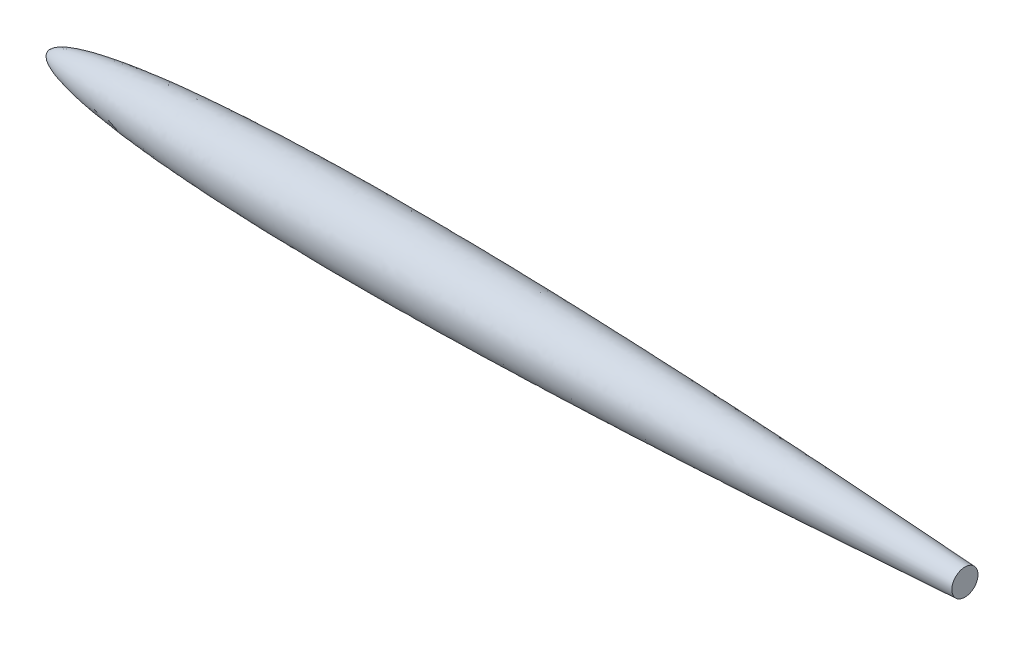
from build123d import *

# Parameters (mm, degrees)
SKETCH3_R          = 660
CUT_EXTRUDE3_DEPTH = 2750


with BuildPart() as part:
    # Sketch2 → Revolve1 (revolve)
    with BuildSketch(Plane(origin=(0, 0, 0), x_dir=(1, 0, 0), z_dir=(0, 1, 0))):
        with BuildLine():
            Line((0, 0), (10999.999999956, 0))
            add(Edge.make_bspline(
                [(0, 0), (0.000193085, 1.416582005), (0.122535707, 4.240766735), (0.673873379, 8.454686711), (2.109656818, 13.93845879), (4.130019916, 19.114733958), (6.6108994, 23.964322659), (9.99141312, 29.368131534), (13.807367772, 34.371487293), (18.005055091, 39.082436475), (24.006567174, 45.012475537), (32.38394762, 52.235407337), (43.384048479, 60.194382801), (57.076069362, 68.618071155), (73.982979094, 77.724284629), (92.789267205, 86.643497962), (113.957785626, 95.516746756), (137.455558775, 104.311070441), (166.299503437, 114.136034239), (201.291019257, 124.83380424), (243.070199966, 136.204737597), (291.673004407, 147.963968929), (341.243287097, 158.777969553), (390.608018364, 168.603047356), (439.719156269, 177.608967602), (500.651651233, 187.980684512), (573.469223954, 199.282575084), (658.612232457, 211.186619601), (758.084154261, 223.607887379), (859.684753543, 234.995657417), (963.386980877, 245.464526813), (1069.170635517, 255.102838422), (1175.032596375, 263.835414151), (1280.957756037, 271.761542521), (1386.934581972, 278.961621428), (1492.954015963, 285.502236935), (1625.576964572, 292.92625555), (1784.827209807, 300.723903313), (1970.721088819, 308.376208718), (2183.266072595, 315.387382682), (2395.855799018, 320.860371196), (2608.476211677, 324.955727124), (2821.116716446, 327.806853269), (3033.769186056, 329.526860463), (3299.591922929, 330.384071953), (3618.580812423, 329.51376855), (3990.72040312, 326.052290628), (4415.985201558, 319.209099979), (4841.201558001, 309.857366009), (5266.363404659, 298.307409926), (5691.467689192, 284.815056798), (6116.513213537, 269.590680591), (6541.499783708, 252.805735362), (6966.427609761, 234.597307897), (7391.296846912, 215.071528615), (7816.107239775, 194.306117581), (8187.764015614, 175.096544232), (8506.288418888, 157.904884652), (8771.698784384, 143.095088012), (8984.01062255, 130.95609046), (9196.305479292, 118.523403245), (9382.048027901, 107.384401544), (9541.24447253, 97.647382895), (9673.900203702, 89.40493478), (9780.020008578, 82.733097614), (9912.663326878, 74.294734049), (10032.03499694, 66.58027009), (10138.136351112, 59.627723881), (10230.971046534, 53.471278218), (10284.016761583, 49.932402374), (10337.064143493, 46.372127364), (10390.104279802, 42.790919783), (10443.152990441, 39.18744375), (10496.183419271, 35.563459924), (10549.240167305, 31.915530826), (10602.249493916, 28.248814521), (10655.332945198, 24.554271665), (10708.28973189, 20.846283715), (10761.453592237, 17.100380429), (10814.258157127, 13.357501973), (10861.039415372, 10.020132172), (10900.208423325, 7.212345677), (10934.336848159, 4.754530233), (10958.871036751, 2.983522743), (10981.803250473, 1.321442896), (10993.97273069, 0.438031797), (10999.999999956, 0)],
                knots=[0, 0, 0, 0, 0, 0.000464454, 0.000928907, 0.001393361, 0.001857814, 0.002287128, 0.002716441, 0.003486019, 0.003922473, 0.004358926, 0.005488094, 0.007117503, 0.008377929, 0.009638355, 0.011796648, 0.013954941, 0.015918589, 0.017882237, 0.021809533, 0.025977713, 0.030145893, 0.034314073, 0.038482253, 0.042518279, 0.046554305, 0.054626357, 0.062698409, 0.070770462, 0.079497478, 0.088224494, 0.09695151, 0.105678526, 0.114405542, 0.123132558, 0.131859574, 0.14058659, 0.158058513, 0.175530436, 0.193002359, 0.210474282, 0.227946206, 0.24541813, 0.262890054, 0.280361977, 0.315305825, 0.350249672, 0.38519352, 0.420137368, 0.455081215, 0.490025063, 0.524968911, 0.559912758, 0.594856606, 0.629800453, 0.664744301, 0.699688149, 0.717160073, 0.734631996, 0.75210392, 0.769575844, 0.787047768, 0.79578373, 0.804519691, 0.813255653, 0.821991615, 0.839463539, 0.84383152, 0.848199501, 0.852567482, 0.856935463, 0.861303444, 0.865671425, 0.870039406, 0.874407387, 0.878775368, 0.883143349, 0.88751133, 0.891879311, 0.896247292, 0.900615273, 0.902799263, 0.904983254, 0.907167244, 0.909351235, 0.909351235, 0.909351235, 0.909351235, 0.909351235], degree=4))
        make_face()
    revolve(axis=Axis((0, 0, 0), (1, 0, 0)))

    # Sketch3 → Cut-Extrude3 (cut)
    with BuildSketch(Plane(origin=(9020, 0, 0), x_dir=(0, 0, -1), z_dir=(1, 0, 0))):
        Circle(SKETCH3_R)
    extrude(amount=CUT_EXTRUDE3_DEPTH, mode=Mode.SUBTRACT)


solid = part.part
